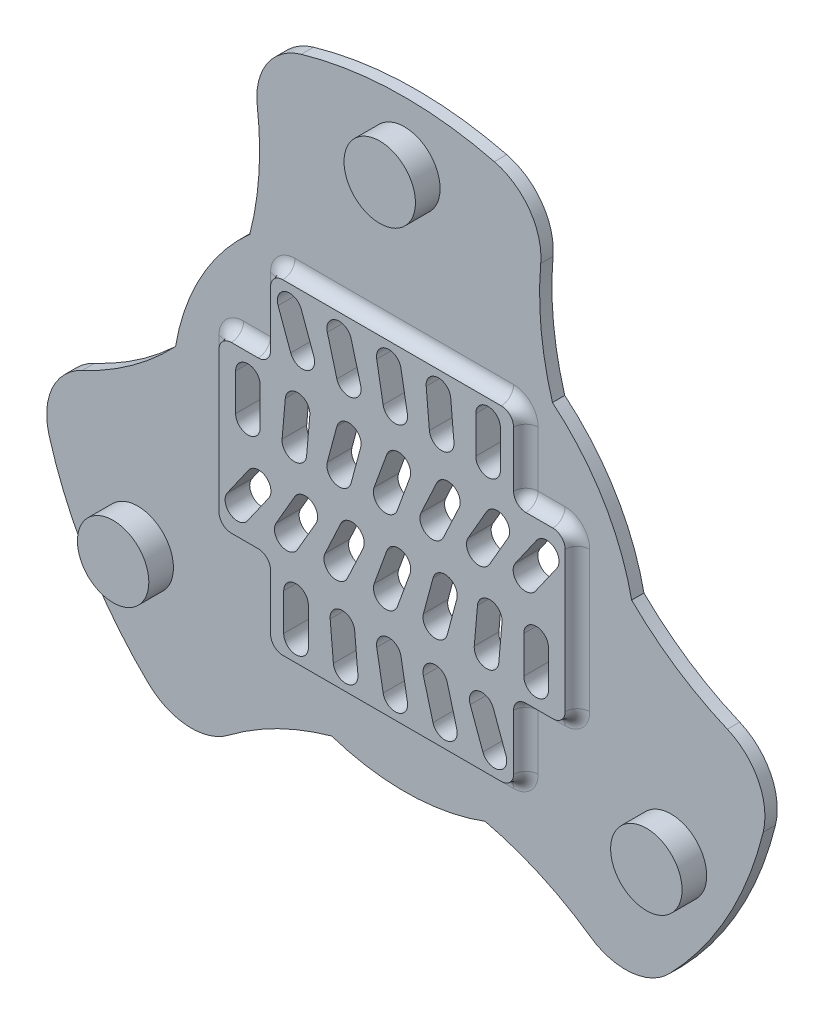
from build123d import *

# Parameters (mm, degrees)
SKETCH2_R           = 18.85
BOSS_EXTRUDE1_DEPTH = 8
SKETCH3_R           = 30
SKETCH3_R_2         = 17.600030795
BOSS_EXTRUDE2_DEPTH = 8
SKETCH4_R           = 2.9
BOSS_EXTRUDE3_DEPTH = 2
SKETCH6_R           = 5
BOSS_EXTRUDE4_DEPTH = 3
SKETCH5_R           = 3
CUT_EXTRUDE1_DEPTH  = 3
SKETCH7_R           = 25
CUT_EXTRUDE2_DEPTH  = 8
FILLET1_R           = 5
SKETCH2_2_R         = 18.85
BOSS_EXTRUDE5_DEPTH = 10
CUT_EXTRUDE3_START  = -2
SKETCH10_R          = 18.85
CUT_EXTRUDE3_DEPTH  = 2
FILLET2_R           = 1
FILLET3_R           = 1
SKETCH11_R          = 37.130250463
CUT_EXTRUDE4_DEPTH  = 7
SKETCH12_R          = 19.177124345
CUT_EXTRUDE5_DEPTH  = 1


with BuildPart() as part:
    # Sketch2 → Boss-Extrude1 (new body)
    with BuildSketch(Plane.XY.offset(10)):
        Circle(SKETCH2_R)
        with BuildLine():
            Line((4.764111012, 11.713944834), (5.02557824, 8.72536074))
            ThreePointArc((5.02557824, 8.72536074), (4.116539285, 7.642010299), (3.033188844, 8.551049254))
            Line((3.033188844, 8.551049254), (2.771721616, 11.539633349))
            ThreePointArc((2.771721616, 11.539633349), (3.680760571, 12.62298379), (4.764111012, 11.713944834))
        make_face(mode=Mode.SUBTRACT)
        with BuildLine():
            Line((0.721986022, 11.783756617), (1.242930555, 8.829333358))
            ThreePointArc((1.242930555, 8.829333358), (0.431770979, 7.670877427), (-0.726684951, 8.482037002))
            Line((-0.726684951, 8.482037002), (-1.247629484, 11.436460261))
            ThreePointArc((-1.247629484, 11.436460261), (-0.436469909, 12.594916192), (0.721986022, 11.783756617))
        make_face(mode=Mode.SUBTRACT)
        with BuildLine():
            Line((-3.324652206, 11.840604594), (-2.548195071, 8.942827115))
            ThreePointArc((-2.548195071, 8.942827115), (-3.255301852, 7.718082244), (-4.480046723, 8.425189025))
            Line((-4.480046723, 8.425189025), (-5.256503859, 11.322966504))
            ThreePointArc((-5.256503859, 11.322966504), (-4.549397078, 12.547711375), (-3.324652206, 11.840604594))
        make_face(mode=Mode.SUBTRACT)
        with BuildLine():
            Line((-7.374687666, 11.884056119), (-6.348627236, 9.064978256))
            ThreePointArc((-6.348627236, 9.064978256), (-6.946299713, 7.783265492), (-8.228012478, 8.38093797))
            Line((-8.228012478, 8.38093797), (-9.254072908, 11.200015832))
            ThreePointArc((-9.254072908, 11.200015832), (-8.65640043, 12.481728596), (-7.374687666, 11.884056119))
        make_face(mode=Mode.SUBTRACT)
        with BuildLine():
            Line((10.016532673, 2.722847178), (11.737262197, 5.180303618))
            ThreePointArc((11.737262197, 5.180303618), (13.129990678, 5.425879226), (13.375566285, 4.033150745))
            Line((13.375566285, 4.033150745), (11.654836761, 1.575694305))
            ThreePointArc((11.654836761, 1.575694305), (10.262108281, 1.330118697), (10.016532673, 2.722847178))
        make_face(mode=Mode.SUBTRACT)
        with BuildLine():
            Line((6.180023981, 2.578960693), (7.680024169, 5.17703723))
            ThreePointArc((7.680024169, 5.17703723), (9.046049573, 5.543062633), (9.412074977, 4.17703723))
            Line((9.412074977, 4.17703723), (7.912074789, 1.578960693))
            ThreePointArc((7.912074789, 1.578960693), (6.546049385, 1.212935289), (6.180023981, 2.578960693))
        make_face(mode=Mode.SUBTRACT)
        with BuildLine():
            Line((2.35581422, 2.441155373), (3.623669164, 5.160079074))
            ThreePointArc((3.623669164, 5.160079074), (4.952595213, 5.643768599), (5.436284738, 4.31484255))
            Line((5.436284738, 4.31484255), (4.168429794, 1.595918849))
            ThreePointArc((4.168429794, 1.595918849), (2.839503745, 1.112229324), (2.35581422, 2.441155373))
        make_face(mode=Mode.SUBTRACT)
        with BuildLine():
            Line((-1.456673421, 2.310479997), (-0.430612863, 5.129558212))
            ThreePointArc((-0.430612863, 5.129558212), (0.851099902, 5.72723069), (1.448772379, 4.445517926))
            Line((1.448772379, 4.445517926), (0.422711821, 1.626439711))
            ThreePointArc((0.422711821, 1.626439711), (-0.859000943, 1.028767233), (-1.456673421, 2.310479997))
        make_face(mode=Mode.SUBTRACT)
        with BuildLine():
            Line((-5.258104963, 2.187929086), (-4.481647731, 5.085706927))
            ThreePointArc((-4.481647731, 5.085706927), (-3.25690286, 5.792813708), (-2.549796078, 4.568068837))
            Line((-2.549796078, 4.568068837), (-3.326253311, 1.670290996))
            ThreePointArc((-3.326253311, 1.670290996), (-4.550998182, 0.963184214), (-5.258104963, 2.187929086))
        make_face(mode=Mode.SUBTRACT)
        with BuildLine():
            Line((-8.92962778, 1.970363305), (-8.668160552, 4.958947399))
            ThreePointArc((-8.668160552, 4.958947399), (-7.584810111, 5.867986354), (-6.675771155, 4.784635913))
            Line((-6.675771155, 4.784635913), (-6.937238384, 1.796051819))
            ThreePointArc((-6.937238384, 1.796051819), (-8.020588824, 0.887012864), (-8.92962778, 1.970363305))
        make_face(mode=Mode.SUBTRACT)
        with BuildLine():
            Line((-12.703950937, 1.877998774), (-12.703950937, 4.877999149))
            ThreePointArc((-12.703950937, 4.877999149), (-11.703950937, 5.877999149), (-10.703950937, 4.877999149))
            Line((-10.703950937, 4.877999149), (-10.703950937, 1.877998774))
            ThreePointArc((-10.703950937, 1.877998774), (-11.703950937, 0.877998774), (-12.703950937, 1.877998774))
        make_face(mode=Mode.SUBTRACT)
        with BuildLine():
            Line((8.797649477, 11.632897752), (8.797649477, 8.632897752))
            ThreePointArc((8.797649477, 8.632897752), (7.797649477, 7.632897752), (6.797649477, 8.632897752))
            Line((6.797649477, 8.632897752), (6.797649477, 11.632897752))
            ThreePointArc((6.797649477, 11.632897752), (7.797649477, 12.632897752), (8.797649477, 11.632897752))
        make_face(mode=Mode.SUBTRACT)
        with BuildLine():
            Line((-4.764111012, -11.713944834), (-5.02557824, -8.72536074))
            ThreePointArc((-5.02557824, -8.72536074), (-4.116539285, -7.642010299), (-3.033188844, -8.551049254))
            Line((-3.033188844, -8.551049254), (-2.771721616, -11.539633349))
            ThreePointArc((-2.771721616, -11.539633349), (-3.680760571, -12.62298379), (-4.764111012, -11.713944834))
        make_face(mode=Mode.SUBTRACT)
        with BuildLine():
            Line((-0.721986022, -11.783756617), (-1.242930555, -8.829333358))
            ThreePointArc((-1.242930555, -8.829333358), (-0.431770979, -7.670877427), (0.726684951, -8.482037002))
            Line((0.726684951, -8.482037002), (1.247629484, -11.436460261))
            ThreePointArc((1.247629484, -11.436460261), (0.436469909, -12.594916192), (-0.721986022, -11.783756617))
        make_face(mode=Mode.SUBTRACT)
        with BuildLine():
            Line((3.324652206, -11.840604594), (2.548195071, -8.942827115))
            ThreePointArc((2.548195071, -8.942827115), (3.255301852, -7.718082244), (4.480046723, -8.425189025))
            Line((4.480046723, -8.425189025), (5.256503859, -11.322966504))
            ThreePointArc((5.256503859, -11.322966504), (4.549397078, -12.547711375), (3.324652206, -11.840604594))
        make_face(mode=Mode.SUBTRACT)
        with BuildLine():
            Line((7.374687666, -11.884056119), (6.348627236, -9.064978256))
            ThreePointArc((6.348627236, -9.064978256), (6.946299713, -7.783265492), (8.228012478, -8.38093797))
            Line((8.228012478, -8.38093797), (9.254072908, -11.200015832))
            ThreePointArc((9.254072908, -11.200015832), (8.65640043, -12.481728596), (7.374687666, -11.884056119))
        make_face(mode=Mode.SUBTRACT)
        with BuildLine():
            Line((-10.016532673, -2.722847178), (-11.737262197, -5.180303618))
            ThreePointArc((-11.737262197, -5.180303618), (-13.129990678, -5.425879226), (-13.375566285, -4.033150745))
            Line((-13.375566285, -4.033150745), (-11.654836761, -1.575694305))
            ThreePointArc((-11.654836761, -1.575694305), (-10.262108281, -1.330118697), (-10.016532673, -2.722847178))
        make_face(mode=Mode.SUBTRACT)
        with BuildLine():
            Line((-6.180023981, -2.578960693), (-7.680024169, -5.17703723))
            ThreePointArc((-7.680024169, -5.17703723), (-9.046049573, -5.543062633), (-9.412074977, -4.17703723))
            Line((-9.412074977, -4.17703723), (-7.912074789, -1.578960693))
            ThreePointArc((-7.912074789, -1.578960693), (-6.546049385, -1.212935289), (-6.180023981, -2.578960693))
        make_face(mode=Mode.SUBTRACT)
        with BuildLine():
            Line((-2.35581422, -2.441155373), (-3.623669164, -5.160079074))
            ThreePointArc((-3.623669164, -5.160079074), (-4.952595213, -5.643768599), (-5.436284738, -4.31484255))
            Line((-5.436284738, -4.31484255), (-4.168429794, -1.595918849))
            ThreePointArc((-4.168429794, -1.595918849), (-2.839503745, -1.112229324), (-2.35581422, -2.441155373))
        make_face(mode=Mode.SUBTRACT)
        with BuildLine():
            Line((1.456673421, -2.310479997), (0.430612863, -5.129558212))
            ThreePointArc((0.430612863, -5.129558212), (-0.851099902, -5.72723069), (-1.448772379, -4.445517926))
            Line((-1.448772379, -4.445517926), (-0.422711821, -1.626439711))
            ThreePointArc((-0.422711821, -1.626439711), (0.859000943, -1.028767233), (1.456673421, -2.310479997))
        make_face(mode=Mode.SUBTRACT)
        with BuildLine():
            Line((5.258104963, -2.187929086), (4.481647731, -5.085706927))
            ThreePointArc((4.481647731, -5.085706927), (3.25690286, -5.792813708), (2.549796078, -4.568068837))
            Line((2.549796078, -4.568068837), (3.326253311, -1.670290996))
            ThreePointArc((3.326253311, -1.670290996), (4.550998182, -0.963184214), (5.258104963, -2.187929086))
        make_face(mode=Mode.SUBTRACT)
        with BuildLine():
            Line((8.92962778, -1.970363305), (8.668160552, -4.958947399))
            ThreePointArc((8.668160552, -4.958947399), (7.584810111, -5.867986354), (6.675771155, -4.784635913))
            Line((6.675771155, -4.784635913), (6.937238384, -1.796051819))
            ThreePointArc((6.937238384, -1.796051819), (8.020588824, -0.887012864), (8.92962778, -1.970363305))
        make_face(mode=Mode.SUBTRACT)
        with BuildLine():
            Line((12.703950937, -1.877998774), (12.703950937, -4.877999149))
            ThreePointArc((12.703950937, -4.877999149), (11.703950937, -5.877999149), (10.703950937, -4.877999149))
            Line((10.703950937, -4.877999149), (10.703950937, -1.877998774))
            ThreePointArc((10.703950937, -1.877998774), (11.703950937, -0.877998774), (12.703950937, -1.877998774))
        make_face(mode=Mode.SUBTRACT)
        with BuildLine():
            Line((-8.797649477, -11.632897752), (-8.797649477, -8.632897752))
            ThreePointArc((-8.797649477, -8.632897752), (-7.797649477, -7.632897752), (-6.797649477, -8.632897752))
            Line((-6.797649477, -8.632897752), (-6.797649477, -11.632897752))
            ThreePointArc((-6.797649477, -11.632897752), (-7.797649477, -12.632897752), (-8.797649477, -11.632897752))
        make_face(mode=Mode.SUBTRACT)
    extrude(amount=BOSS_EXTRUDE1_DEPTH)

    # Sketch3 → Boss-Extrude2 (add)
    with BuildSketch(Plane.XY.offset(18)):
        Circle(SKETCH3_R)
        Circle(SKETCH3_R_2, mode=Mode.SUBTRACT)
    extrude(amount=-BOSS_EXTRUDE2_DEPTH)

    # Sketch4 → Boss-Extrude3 (add)
    with BuildSketch(Plane.XY.offset(18)):
        with Locations((0, 25)):
            Circle(SKETCH4_R)
        with Locations((21.650635095, -12.5)):
            Circle(SKETCH4_R)
        with Locations((-21.650635095, -12.5)):
            Circle(SKETCH4_R)
    extrude(amount=BOSS_EXTRUDE3_DEPTH)

    # Sketch6 → Boss-Extrude4 (add)
    with BuildSketch(Plane(origin=(0, 0, 10), x_dir=(-1, 0, 0), z_dir=(0, 0, -1))):
        with Locations((0, 30)):
            Circle(SKETCH6_R)
        with Locations((25.980762114, -15)):
            Circle(SKETCH6_R)
        with Locations((-25.980762114, -15)):
            Circle(SKETCH6_R)
    extrude(amount=-BOSS_EXTRUDE4_DEPTH)

    # Sketch5 → Cut-Extrude1 (cut)
    with BuildSketch(Plane(origin=(0, 0, 10), x_dir=(-1, 0, 0), z_dir=(0, 0, -1))):
        with Locations((0, 25)):
            Circle(SKETCH5_R)
        with Locations((21.650635095, -12.5)):
            Circle(SKETCH5_R)
        with Locations((-21.650635095, -12.5)):
            Circle(SKETCH5_R)
    extrude(amount=-CUT_EXTRUDE1_DEPTH, mode=Mode.SUBTRACT)

    # Sketch7 → Cut-Extrude2 (cut)
    with BuildSketch(Plane(origin=(0, 0, 10), x_dir=(-1, 0, 0), z_dir=(0, 0, -1))):
        with Locations((-35.980083702, 21.666415873)):
            Circle(SKETCH7_R)
        with Locations((36.753708406, 20.32645858)):
            Circle(SKETCH7_R)
        with Locations((-0.773624703, -41.992874453)):
            Circle(SKETCH7_R)
    extrude(amount=-CUT_EXTRUDE2_DEPTH, mode=Mode.SUBTRACT)

    # Fillet1
    fillet1_edges = [part.edges().sort_by_distance(p)[0] for p in [
        (29.888839754, -2.580166302, 14),
        (11.700383981, 27.624283062, 14),
        (-12.709930313, 27.174577668, 14),
        (-29.773522884, -3.679311769, 14),
        (-17.178909441, -24.594411366, 14),
        (18.073138902, -23.944971293, 14),
    ]]
    fillet(fillet1_edges, radius=FILLET1_R)

    # Sketch2<2> → Boss-Extrude5 (add)
    with BuildSketch(Plane.XY.offset(10)):
        with Locations(Location((0, 0, 0), (0, 0, 170.365488853))):
            Circle(SKETCH2_2_R)
        with BuildLine():
            Line((4.764111012, 11.713944834), (5.02557824, 8.72536074))
            ThreePointArc((5.02557824, 8.72536074), (4.116539285, 7.642010299), (3.033188844, 8.551049254))
            Line((3.033188844, 8.551049254), (2.771721616, 11.539633349))
            ThreePointArc((2.771721616, 11.539633349), (3.680760571, 12.62298379), (4.764111012, 11.713944834))
        make_face(mode=Mode.SUBTRACT)
        with BuildLine():
            Line((0.721986022, 11.783756617), (1.242930555, 8.829333358))
            ThreePointArc((1.242930555, 8.829333358), (0.431770979, 7.670877427), (-0.726684951, 8.482037002))
            Line((-0.726684951, 8.482037002), (-1.247629484, 11.436460261))
            ThreePointArc((-1.247629484, 11.436460261), (-0.436469909, 12.594916192), (0.721986022, 11.783756617))
        make_face(mode=Mode.SUBTRACT)
        with BuildLine():
            Line((-3.324652206, 11.840604594), (-2.548195071, 8.942827115))
            ThreePointArc((-2.548195071, 8.942827115), (-3.255301852, 7.718082244), (-4.480046723, 8.425189025))
            Line((-4.480046723, 8.425189025), (-5.256503859, 11.322966504))
            ThreePointArc((-5.256503859, 11.322966504), (-4.549397078, 12.547711375), (-3.324652206, 11.840604594))
        make_face(mode=Mode.SUBTRACT)
        with BuildLine():
            Line((-7.374687666, 11.884056119), (-6.348627236, 9.064978256))
            ThreePointArc((-6.348627236, 9.064978256), (-6.946299713, 7.783265492), (-8.228012478, 8.38093797))
            Line((-8.228012478, 8.38093797), (-9.254072908, 11.200015832))
            ThreePointArc((-9.254072908, 11.200015832), (-8.65640043, 12.481728596), (-7.374687666, 11.884056119))
        make_face(mode=Mode.SUBTRACT)
        with BuildLine():
            Line((10.016532673, 2.722847178), (11.737262197, 5.180303618))
            ThreePointArc((11.737262197, 5.180303618), (13.129990678, 5.425879226), (13.375566285, 4.033150745))
            Line((13.375566285, 4.033150745), (11.654836761, 1.575694305))
            ThreePointArc((11.654836761, 1.575694305), (10.262108281, 1.330118697), (10.016532673, 2.722847178))
        make_face(mode=Mode.SUBTRACT)
        with BuildLine():
            Line((6.180023981, 2.578960693), (7.680024169, 5.17703723))
            ThreePointArc((7.680024169, 5.17703723), (9.046049573, 5.543062633), (9.412074977, 4.17703723))
            Line((9.412074977, 4.17703723), (7.912074789, 1.578960693))
            ThreePointArc((7.912074789, 1.578960693), (6.546049385, 1.212935289), (6.180023981, 2.578960693))
        make_face(mode=Mode.SUBTRACT)
        with BuildLine():
            Line((2.35581422, 2.441155373), (3.623669164, 5.160079074))
            ThreePointArc((3.623669164, 5.160079074), (4.952595213, 5.643768599), (5.436284738, 4.31484255))
            Line((5.436284738, 4.31484255), (4.168429794, 1.595918849))
            ThreePointArc((4.168429794, 1.595918849), (2.839503745, 1.112229324), (2.35581422, 2.441155373))
        make_face(mode=Mode.SUBTRACT)
        with BuildLine():
            Line((-1.456673421, 2.310479997), (-0.430612863, 5.129558212))
            ThreePointArc((-0.430612863, 5.129558212), (0.851099902, 5.72723069), (1.448772379, 4.445517926))
            Line((1.448772379, 4.445517926), (0.422711821, 1.626439711))
            ThreePointArc((0.422711821, 1.626439711), (-0.859000943, 1.028767233), (-1.456673421, 2.310479997))
        make_face(mode=Mode.SUBTRACT)
        with BuildLine():
            Line((-5.258104963, 2.187929086), (-4.481647731, 5.085706927))
            ThreePointArc((-4.481647731, 5.085706927), (-3.25690286, 5.792813708), (-2.549796078, 4.568068837))
            Line((-2.549796078, 4.568068837), (-3.326253311, 1.670290996))
            ThreePointArc((-3.326253311, 1.670290996), (-4.550998182, 0.963184214), (-5.258104963, 2.187929086))
        make_face(mode=Mode.SUBTRACT)
        with BuildLine():
            Line((-8.92962778, 1.970363305), (-8.668160552, 4.958947399))
            ThreePointArc((-8.668160552, 4.958947399), (-7.584810111, 5.867986354), (-6.675771155, 4.784635913))
            Line((-6.675771155, 4.784635913), (-6.937238384, 1.796051819))
            ThreePointArc((-6.937238384, 1.796051819), (-8.020588824, 0.887012864), (-8.92962778, 1.970363305))
        make_face(mode=Mode.SUBTRACT)
        with BuildLine():
            Line((-12.703950937, 1.877998774), (-12.703950937, 4.877999149))
            ThreePointArc((-12.703950937, 4.877999149), (-11.703950937, 5.877999149), (-10.703950937, 4.877999149))
            Line((-10.703950937, 4.877999149), (-10.703950937, 1.877998774))
            ThreePointArc((-10.703950937, 1.877998774), (-11.703950937, 0.877998774), (-12.703950937, 1.877998774))
        make_face(mode=Mode.SUBTRACT)
        with BuildLine():
            Line((8.797649477, 11.632897752), (8.797649477, 8.632897752))
            ThreePointArc((8.797649477, 8.632897752), (7.797649477, 7.632897752), (6.797649477, 8.632897752))
            Line((6.797649477, 8.632897752), (6.797649477, 11.632897752))
            ThreePointArc((6.797649477, 11.632897752), (7.797649477, 12.632897752), (8.797649477, 11.632897752))
        make_face(mode=Mode.SUBTRACT)
        with BuildLine():
            Line((-4.764111012, -11.713944834), (-5.02557824, -8.72536074))
            ThreePointArc((-5.02557824, -8.72536074), (-4.116539285, -7.642010299), (-3.033188844, -8.551049254))
            Line((-3.033188844, -8.551049254), (-2.771721616, -11.539633349))
            ThreePointArc((-2.771721616, -11.539633349), (-3.680760571, -12.62298379), (-4.764111012, -11.713944834))
        make_face(mode=Mode.SUBTRACT)
        with BuildLine():
            Line((-0.721986022, -11.783756617), (-1.242930555, -8.829333358))
            ThreePointArc((-1.242930555, -8.829333358), (-0.431770979, -7.670877427), (0.726684951, -8.482037002))
            Line((0.726684951, -8.482037002), (1.247629484, -11.436460261))
            ThreePointArc((1.247629484, -11.436460261), (0.436469909, -12.594916192), (-0.721986022, -11.783756617))
        make_face(mode=Mode.SUBTRACT)
        with BuildLine():
            Line((3.324652206, -11.840604594), (2.548195071, -8.942827115))
            ThreePointArc((2.548195071, -8.942827115), (3.255301852, -7.718082244), (4.480046723, -8.425189025))
            Line((4.480046723, -8.425189025), (5.256503859, -11.322966504))
            ThreePointArc((5.256503859, -11.322966504), (4.549397078, -12.547711375), (3.324652206, -11.840604594))
        make_face(mode=Mode.SUBTRACT)
        with BuildLine():
            Line((7.374687666, -11.884056119), (6.348627236, -9.064978256))
            ThreePointArc((6.348627236, -9.064978256), (6.946299713, -7.783265492), (8.228012478, -8.38093797))
            Line((8.228012478, -8.38093797), (9.254072908, -11.200015832))
            ThreePointArc((9.254072908, -11.200015832), (8.65640043, -12.481728596), (7.374687666, -11.884056119))
        make_face(mode=Mode.SUBTRACT)
        with BuildLine():
            Line((-10.016532673, -2.722847178), (-11.737262197, -5.180303618))
            ThreePointArc((-11.737262197, -5.180303618), (-13.129990678, -5.425879226), (-13.375566285, -4.033150745))
            Line((-13.375566285, -4.033150745), (-11.654836761, -1.575694305))
            ThreePointArc((-11.654836761, -1.575694305), (-10.262108281, -1.330118697), (-10.016532673, -2.722847178))
        make_face(mode=Mode.SUBTRACT)
        with BuildLine():
            Line((-6.180023981, -2.578960693), (-7.680024169, -5.17703723))
            ThreePointArc((-7.680024169, -5.17703723), (-9.046049573, -5.543062633), (-9.412074977, -4.17703723))
            Line((-9.412074977, -4.17703723), (-7.912074789, -1.578960693))
            ThreePointArc((-7.912074789, -1.578960693), (-6.546049385, -1.212935289), (-6.180023981, -2.578960693))
        make_face(mode=Mode.SUBTRACT)
        with BuildLine():
            Line((-2.35581422, -2.441155373), (-3.623669164, -5.160079074))
            ThreePointArc((-3.623669164, -5.160079074), (-4.952595213, -5.643768599), (-5.436284738, -4.31484255))
            Line((-5.436284738, -4.31484255), (-4.168429794, -1.595918849))
            ThreePointArc((-4.168429794, -1.595918849), (-2.839503745, -1.112229324), (-2.35581422, -2.441155373))
        make_face(mode=Mode.SUBTRACT)
        with BuildLine():
            Line((1.456673421, -2.310479997), (0.430612863, -5.129558212))
            ThreePointArc((0.430612863, -5.129558212), (-0.851099902, -5.72723069), (-1.448772379, -4.445517926))
            Line((-1.448772379, -4.445517926), (-0.422711821, -1.626439711))
            ThreePointArc((-0.422711821, -1.626439711), (0.859000943, -1.028767233), (1.456673421, -2.310479997))
        make_face(mode=Mode.SUBTRACT)
        with BuildLine():
            Line((5.258104963, -2.187929086), (4.481647731, -5.085706927))
            ThreePointArc((4.481647731, -5.085706927), (3.25690286, -5.792813708), (2.549796078, -4.568068837))
            Line((2.549796078, -4.568068837), (3.326253311, -1.670290996))
            ThreePointArc((3.326253311, -1.670290996), (4.550998182, -0.963184214), (5.258104963, -2.187929086))
        make_face(mode=Mode.SUBTRACT)
        with BuildLine():
            Line((8.92962778, -1.970363305), (8.668160552, -4.958947399))
            ThreePointArc((8.668160552, -4.958947399), (7.584810111, -5.867986354), (6.675771155, -4.784635913))
            Line((6.675771155, -4.784635913), (6.937238384, -1.796051819))
            ThreePointArc((6.937238384, -1.796051819), (8.020588824, -0.887012864), (8.92962778, -1.970363305))
        make_face(mode=Mode.SUBTRACT)
        with BuildLine():
            Line((12.703950937, -1.877998774), (12.703950937, -4.877999149))
            ThreePointArc((12.703950937, -4.877999149), (11.703950937, -5.877999149), (10.703950937, -4.877999149))
            Line((10.703950937, -4.877999149), (10.703950937, -1.877998774))
            ThreePointArc((10.703950937, -1.877998774), (11.703950937, -0.877998774), (12.703950937, -1.877998774))
        make_face(mode=Mode.SUBTRACT)
        with BuildLine():
            Line((-8.797649477, -11.632897752), (-8.797649477, -8.632897752))
            ThreePointArc((-8.797649477, -8.632897752), (-7.797649477, -7.632897752), (-6.797649477, -8.632897752))
            Line((-6.797649477, -8.632897752), (-6.797649477, -11.632897752))
            ThreePointArc((-6.797649477, -11.632897752), (-7.797649477, -12.632897752), (-8.797649477, -11.632897752))
        make_face(mode=Mode.SUBTRACT)
    extrude(amount=BOSS_EXTRUDE5_DEPTH)

    # Sketch10 → Cut-Extrude3 (cut)
    with BuildSketch(Plane.XY.offset(20).offset(CUT_EXTRUDE3_START)):
        Circle(SKETCH10_R)
        Polygon((-9.868323971, 6.706489919), (-9.868323971, 13.206875856), (9.868323971, 13.206875856), (9.868323971, 6.706489919), (14.053503957, 6.706489919), (14.053503957, -6.706489919), (9.868323971, -6.706489919), (9.868323971, -13.206875856), (-9.868323971, -13.206875856), (-9.868323971, -6.706489919), (-14.053503957, -6.706489919), (-14.053503957, 6.706489919), align=None, mode=Mode.SUBTRACT)
    extrude(amount=CUT_EXTRUDE3_DEPTH, mode=Mode.SUBTRACT)

    # Fillet2
    fillet2_edges = [part.edges().sort_by_distance(p)[0] for p in [
        (-9.868323971, 9.956682888, 18),
        (-14.053503957, 0, 18),
        (-11.960913964, -6.706489919, 18),
        (-9.868323971, -9.956682888, 18),
        (0, -13.206875856, 18),
        (11.960913964, -6.706489919, 18),
        (11.960913964, 6.706489919, 18),
        (14.053503957, 6.706489919, 19),
        (9.868323971, 9.956682888, 18),
        (0, 13.206875856, 18),
        (9.868323971, 13.206875856, 19),
        (-9.868323971, 13.206875856, 19),
        (-11.960913964, 6.706489919, 18),
        (-9.868323971, 6.706489919, 19),
        (-14.053503957, 6.706489919, 19),
        (-14.053503957, -6.706489919, 19),
        (-9.868323971, -6.706489919, 19),
        (-9.868323971, -13.206875856, 19),
        (9.868323971, -9.956682888, 18),
        (9.868323971, -13.206875856, 19),
        (9.868323971, -6.706489919, 19),
        (14.053503957, 0, 18),
        (14.053503957, -6.706489919, 19),
    ]]
    fillet(fillet2_edges, radius=FILLET2_R)

    # Fillet3
    # the kernel refuses this fillet: 1 mm, written as the material it adds along each edge
    with BuildSketch(Plane(origin=(10.868323971, 7.706489919, 19), x_dir=(0, -1, 0), z_dir=(-1, 0, 0))) as fillet3_piece_1_section:
        Polygon((0, 0), (FILLET3_R, 0), (FILLET3_R, -FILLET3_R), (0, -FILLET3_R), align=None)
    fillet3_piece_1 = extrude(amount=FILLET3_R, mode=Mode.PRIVATE)
    fillet3_piece_1 = fillet3_piece_1 - Plane(origin=(10.868323971, 7.706489919, 19), x_dir=(0, 0.7071067811865475, 0.7071067811865475), z_dir=(-1, 0, 0)) * Sphere(FILLET3_R, mode=Mode.PRIVATE)
    add(fillet3_piece_1)
    with BuildSketch(Plane(origin=(9.868323971, 6.706489919, 19), x_dir=(0, 1, 0), z_dir=(0, 0, 1))) as fillet3_piece_2:
        with BuildLine():
            CenterArc((FILLET3_R, -FILLET3_R), FILLET3_R, 90, 90)
            Line((0, -FILLET3_R), (0, 0))
            Line((0, 0), (FILLET3_R, 0))
        make_face()
    extrude(amount=1)

    # Sketch11 → Cut-Extrude4 (cut)
    with BuildSketch(Plane(origin=(0, 0, 10), x_dir=(-1, 0, 0), z_dir=(0, 0, -1))):
        Circle(SKETCH11_R)
    extrude(amount=-CUT_EXTRUDE4_DEPTH, mode=Mode.SUBTRACT)

    # Sketch12 → Cut-Extrude5 (cut)
    with BuildSketch(Plane.XY.offset(20)):
        Circle(SKETCH12_R)
    extrude(amount=-CUT_EXTRUDE5_DEPTH, mode=Mode.SUBTRACT)


solid = part.part
